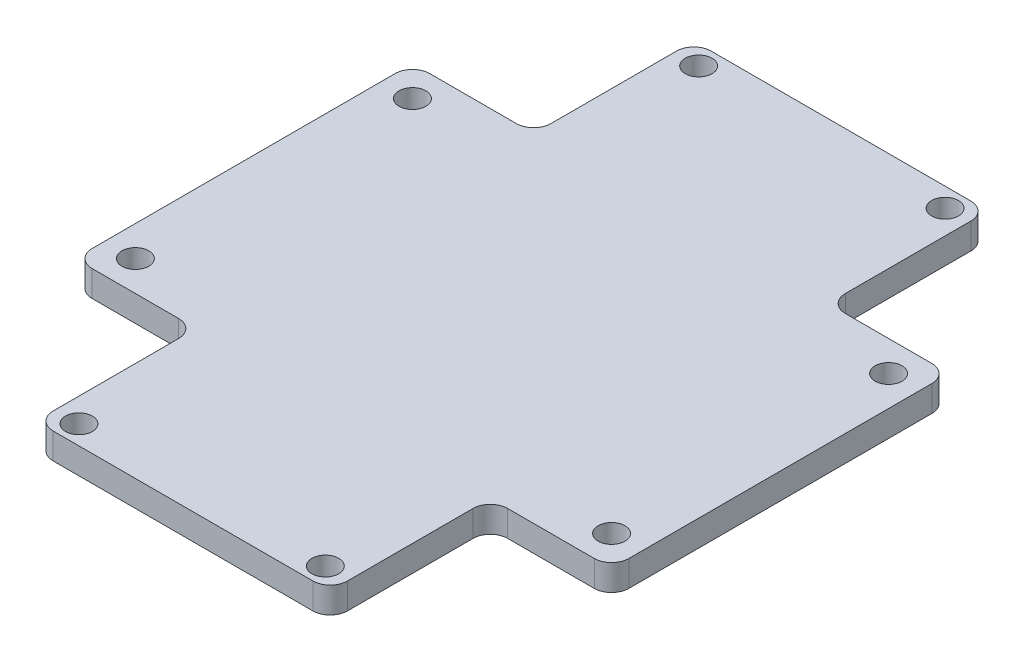
from build123d import *

# Parameters (mm, degrees)
SKETCH_1_R      = 1.55
EXTRUDE_1_DEPTH = 3
FILLET_1_R      = 2


with BuildPart() as part:
    # 草图1 → 凸台-拉伸1 (new body)
    with BuildSketch(Plane(origin=(0, 0, 0), x_dir=(1, 0, 0), z_dir=(0, 1, 0))):
        Polygon((-17, 19.5), (-31, 19.5), (-31, -19.5), (-17, -19.5), (-17, -38), (17, -38), (17, -19.5), (31, -19.5), (31, 19.5), (17, 19.5), (17, 38), (-17, 38), align=None)
        with Locations((-27.5, -16)):
            Circle(SKETCH_1_R, mode=Mode.SUBTRACT)
        with Locations((-27.5, 16)):
            Circle(SKETCH_1_R, mode=Mode.SUBTRACT)
        with Locations((14.23, 35.79)):
            Circle(SKETCH_1_R, mode=Mode.SUBTRACT)
        with Locations((-14.23, 35.79)):
            Circle(SKETCH_1_R, mode=Mode.SUBTRACT)
        with Locations((27.5, 16)):
            Circle(SKETCH_1_R, mode=Mode.SUBTRACT)
        with Locations((27.5, -16)):
            Circle(SKETCH_1_R, mode=Mode.SUBTRACT)
        with Locations((14.23, -35.79)):
            Circle(SKETCH_1_R, mode=Mode.SUBTRACT)
        with Locations((-14.23, -35.79)):
            Circle(SKETCH_1_R, mode=Mode.SUBTRACT)
    extrude(amount=EXTRUDE_1_DEPTH)

    # 圆角1
    fillet_1_edges = [part.edges().sort_by_distance(p)[0] for p in [
        (-31, 1.5, -19.5),
        (31, 1.5, -19.5),
        (31, 1.5, 19.5),
        (-31, 1.5, 19.5),
        (17, 1.5, 38),
        (-17, 1.5, 38),
        (-17, 1.5, 19.5),
        (17, 1.5, 19.5),
        (17, 1.5, -19.5),
        (-17, 1.5, -19.5),
        (17, 1.5, -38),
        (-17, 1.5, -38),
    ]]
    fillet(fillet_1_edges, radius=FILLET_1_R)


solid = part.part
